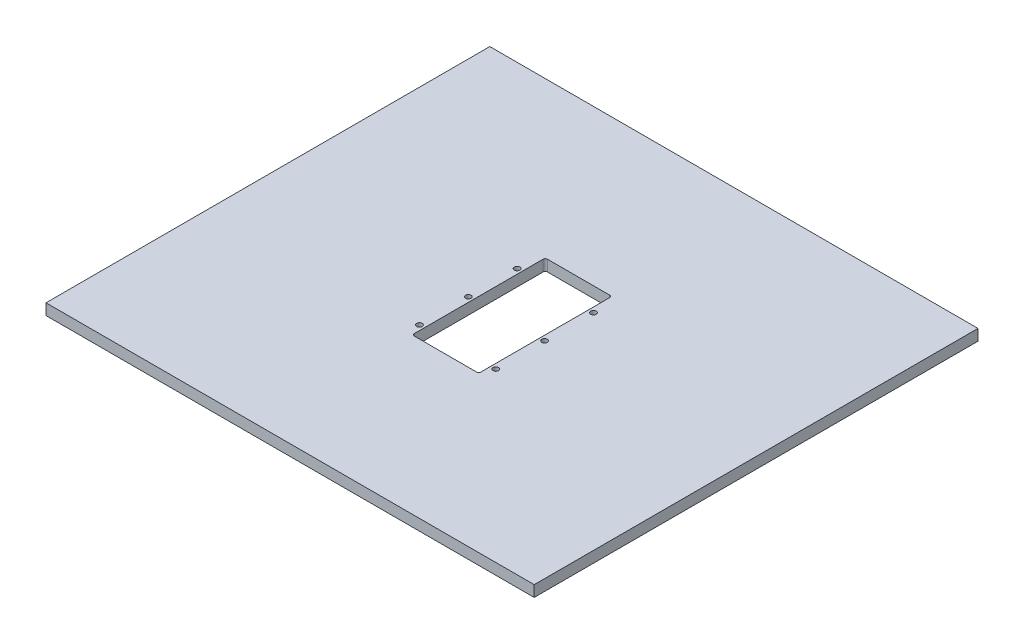
from build123d import *

# Parameters (mm, degrees)
ESBO_O1_R                = 1.25
RESSALTO_EXTRUS_O1_DEPTH = 5


with BuildPart() as part:
    # Esboço1 → Ressalto-extrusão1 (new body)
    with BuildSketch(Plane(origin=(0, 0, 0), x_dir=(1, 0, 0), z_dir=(0, 1, 0))):
        Polygon((-100, -100), (100, -100), (110, -100), (110, -90), (110, 90), (110, 100), (100, 100), (-100, 100), (-110, 100), (-110, 90), (-110, -90), (-110, -100), align=None)
        with Locations((-17.2, -24.5)):
            Circle(ESBO_O1_R, mode=Mode.SUBTRACT)
        with Locations((-17.2, -2.5)):
            Circle(ESBO_O1_R, mode=Mode.SUBTRACT)
        with Locations((17.2, -24.5)):
            Circle(ESBO_O1_R, mode=Mode.SUBTRACT)
        with BuildLine():
            Line((-14, 30), (14, 30))
            ThreePointArc((14, 30), (14.707106781, 29.707106781), (15, 29))
            Line((15, 29), (15, -29))
            ThreePointArc((15, -29), (14.707106781, -29.707106781), (14, -30))
            Line((14, -30), (-14, -30))
            ThreePointArc((-14, -30), (-14.707106781, -29.707106781), (-15, -29))
            Line((-15, -29), (-15, 29))
            ThreePointArc((-15, 29), (-14.707106781, 29.707106781), (-14, 30))
        make_face(mode=Mode.SUBTRACT)
        with Locations((17.2, -2.5)):
            Circle(ESBO_O1_R, mode=Mode.SUBTRACT)
        with Locations((-17.2, 19.5)):
            Circle(ESBO_O1_R, mode=Mode.SUBTRACT)
        with Locations((17.2, 19.5)):
            Circle(ESBO_O1_R, mode=Mode.SUBTRACT)
    extrude(amount=RESSALTO_EXTRUS_O1_DEPTH)


solid = part.part
